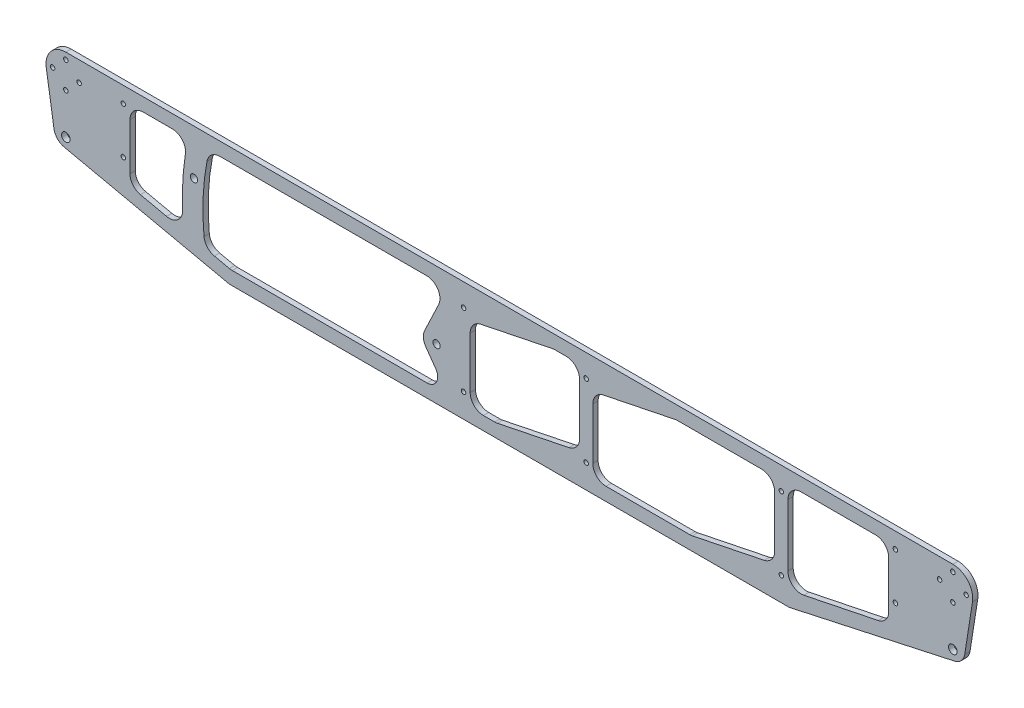
from build123d import *

# Parameters (mm, degrees)
SKETCH_1_R          = 3.25
EXTRUDE_1_DEPTH     = 4
HOLE_WIZARD_M32_D   = 3.4
HOLE_WIZARD_M52_D   = 5.5
CUT_EXTRUDE_3_DEPTH = 353.903669576
FILLET_2_R          = 10
FILLET_3_R          = 10
HOLE_WIZARD_M31_D   = 3.4
FILLET_4_R          = 8


with BuildPart() as part:
    # Эскиз1 → Бобышка-Вытянуть1 (new body)
    with BuildSketch(Plane.XY):
        with BuildLine():
            Line((-349.818316726, 27.672449915), (-342.910885265, -16.303620822))
            Line((-342.910885265, -16.303620822), (-211.481081006, -45))
            Line((-211.481081006, -45), (211.481081006, -45))
            Line((211.481081006, -45), (342.910885265, -16.303620822))
            Line((342.910885265, -16.303620822), (349.818316726, 27.672449915))
            ThreePointArc((349.818316726, 27.672449915), (346.399852001, 39.749019149), (335, 45))
            Line((335, 45), (-335, 45))
            ThreePointArc((-335, 45), (-346.399852001, 39.749019149), (-349.818316726, 27.672449915))
        make_face()
        with Locations((-335, -10.635315981)):
            Circle(SKETCH_1_R, mode=Mode.SUBTRACT)
        with Locations((335, -10.635315981)):
            Circle(SKETCH_1_R, mode=Mode.SUBTRACT)
    extrude(amount=EXTRUDE_1_DEPTH)

    # Отверстие с зазором M32 (through all)
    with Locations(Plane.XY.offset(4)):
        with Locations((-335, 40), (-345, 30), (-335, 20), (-325, 30), (325, 30), (335, 40), (345, 30), (335, 20)):
            Hole(HOLE_WIZARD_M32_D / 2)

    # Отверстие с зазором M52 (through all)
    with Locations(Plane(origin=(0, 0, 0), x_dir=(-1, 0, 0), z_dir=(0, 0, -1))):
        with Locations((55, -6), (238.23, 10.84)):
            Hole(HOLE_WIZARD_M52_D / 2)

    # Эскиз10 → Вырез-Вытянуть3 (cut, through all)
    with BuildSketch(Plane.XY.offset(4)):
        with BuildLine():
            Line((-286.571319769, 35), (-242.571319769, 35))
            ThreePointArc((-242.571319769, 35), (-246.739453064, 3.999106889), (-245.818518827, -27.267178292))
            Line((-245.818518827, -27.267178292), (-286.571319769, -18.369213063))
            Line((-286.571319769, -18.369213063), (-286.571319769, 35))
        make_face()
        with BuildLine():
            Line((-226.671925486, 35), (-46.587816989, 35))
            Line((-46.587816989, 35), (-64.032014151, -1.707830342))
            ThreePointArc((-64.032014151, -1.707830342), (-64.961194769, -6.880112935), (-63.13950341, -11.809344562))
            Line((-63.13950341, -11.809344562), (-46.587816989, -35))
            Line((-46.587816989, -35), (-210.402090952, -35))
            Line((-210.402090952, -35), (-229.752534006, -30.775024894))
            ThreePointArc((-229.752534006, -30.775024894), (-231.306735573, 2.257420391), (-226.671925486, 35))
        make_face()
        Polygon((286.571319769, 35), (286.571319769, -18.369213063), (210.402090952, -34), (210.402090952, 35), align=None)
        Polygon((200.402090952, 35), (126.145146633, 35), (63.036502818, 22.049392771), (63.036502818, -35), (137.293447136, -35), (200.402090952, -22.049392771), align=None)
        Polygon((-29.597909048, 22.049392771), (-29.597909048, -35), (-10.072140997, -35), (53.036502818, -22.049392771), (53.036502818, 35), (33.510734767, 35), align=None)
    extrude(amount=-CUT_EXTRUDE_3_DEPTH, mode=Mode.SUBTRACT)

    # Скругление2
    fillet_2_edges = [part.edges().sort_by_distance(p)[0] for p in [
        (-46.587816989, 35, 2),
        (-210.402090952, -35, 2),
        (-229.752534006, -30.775024894, 2),
        (-226.671925486, 35, 2),
        (-242.571319769, 35, 2),
        (-245.818518827, -27.267178292, 2),
        (-286.571319769, -18.369213063, 2),
        (-286.571319769, 35, 2),
        (-342.910885265, -16.303620822, 2),
        (-211.481081006, -45, 2),
        (211.481081006, -45, 2),
        (342.910885265, -16.303620822, 2),
        (286.571319769, 35, 2),
        (286.571319769, -18.369213063, 2),
        (210.402090952, 35, 2),
        (210.402090952, -34, 2),
    ]]
    fillet(fillet_2_edges, radius=FILLET_2_R)

    # Скругление3
    fillet_3_edges = [part.edges().sort_by_distance(p)[0] for p in [
        (-29.597909048, -35, 2),
        (200.402090952, 35, 2),
        (53.036502818, 35, 2),
        (200.402090952, -22.049392771, 2),
        (137.293447136, -35, 2),
        (33.510734767, 35, 2),
        (-29.597909048, 22.049392771, 2),
        (63.036502818, -35, 2),
        (126.145146633, 35, 2),
        (63.036502818, 22.049392771, 2),
        (53.036502818, -22.049392771, 2),
        (-10.072140997, -35, 2),
    ]]
    fillet(fillet_3_edges, radius=FILLET_3_R)

    # Отверстие с зазором M31 (through all)
    with Locations(Plane.XY.offset(4)):
        with Locations((-34.597909048, 28), (-34.597909048, -27), (205.402090952, -27), (205.402090952, 28), (291.571319769, 33), (291.6163356, -2), (-291.6163356, -2), (-291.571319769, 33), (58.036502818, 28), (58.036502818, -27)):
            Hole(HOLE_WIZARD_M31_D / 2)

    # Скругление4
    fillet_4_edges = [part.edges().sort_by_distance(p)[0] for p in [
        (-46.587816989, -35, 2),
    ]]
    fillet(fillet_4_edges, radius=FILLET_4_R)


solid = part.part
